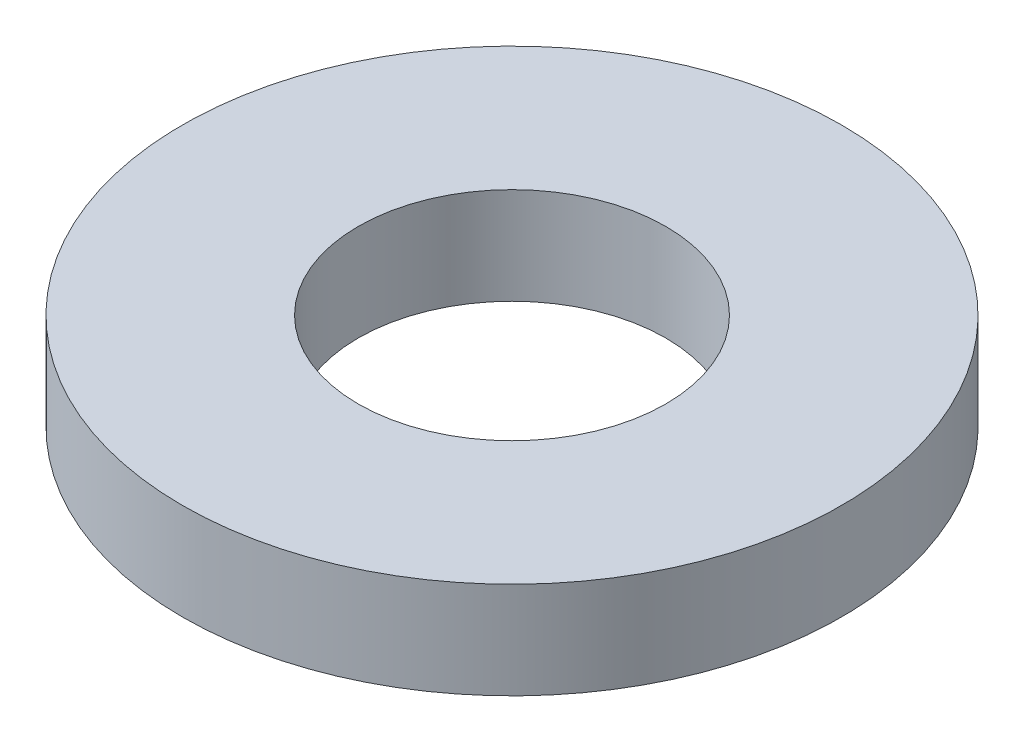
from build123d import *

# Parameters (mm, degrees)
SKETCH1_R           = 75
BOSS_EXTRUDE1_DEPTH = 22
SKETCH2_R           = 35
CUT_EXTRUDE1_DEPTH  = 109.323589305


with BuildPart() as part:
    # Sketch1 → Boss-Extrude1 (new body)
    with BuildSketch(Plane(origin=(0, 0, 0), x_dir=(1, 0, 0), z_dir=(0, 1, 0))):
        Circle(SKETCH1_R)
    extrude(amount=BOSS_EXTRUDE1_DEPTH)

    # Sketch2 → Cut-Extrude1 (cut, through all)
    with BuildSketch(Plane(origin=(0, 0, 0), x_dir=(1, 0, 0), z_dir=(0, 1, 0))):
        Circle(SKETCH2_R)
    extrude(amount=CUT_EXTRUDE1_DEPTH, mode=Mode.SUBTRACT)


solid = part.part
